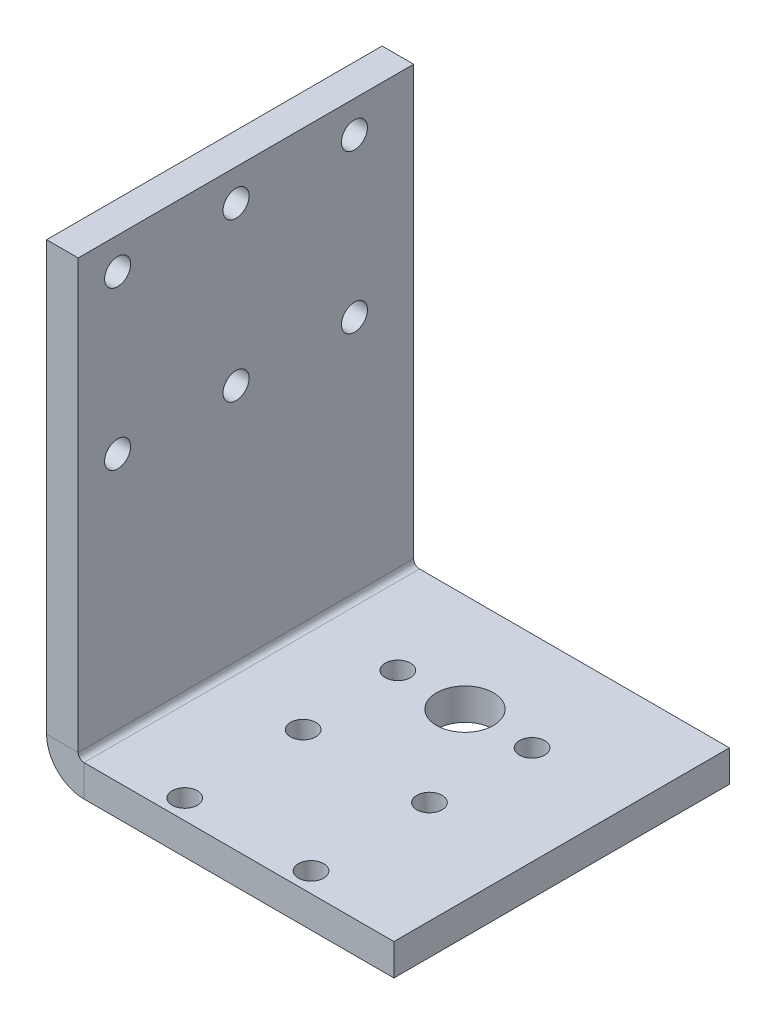
from build123d import *

# Parameters (mm, degrees)
SM_BASE_FLANGE_2_DEPTH = 21.25
HOLE_WIZARD_M3_1_D     = 3.2
SKETCH_24_R            = 3.6
CUT_EXTRUDE_2_DEPTH    = 75.381197221
M4X0_7_1_D             = 3.3
HOLE_WIZARD_M3_2_D     = 3.2
PATTERN_LINEAR_1_COUNT = 3
PATTERN_LINEAR_1_PITCH = 15


# Sheet-metal steps are written as plain solids
with BuildPart() as part:
    # 草圖16 → 基材-凸緣2 (new, symmetric)
    with BuildSketch(Plane.XY):
        with BuildLine():
            Line((40, 0), (0.7366, 0))
            ThreePointArc((0.7366, 0), (0.215745145, 0.215745145), (0, 0.7366))
            Line((0, 0.7366), (0, 55))
            Line((0, 55), (-4, 55))
            Line((-4, 55), (-4, 0.7366))
            ThreePointArc((-4, 0.7366), (-2.61268198, -2.61268198), (0.7366, -4))
            Line((0.7366, -4), (40, -4))
            Line((40, -4), (40, 0))
        make_face()
    extrude(amount=SM_BASE_FLANGE_2_DEPTH, both=True)

    # M3 餘隙孔1 (through all)
    with Locations(Plane(origin=(0, 0, 0), x_dir=(-1, 0, 0), z_dir=(0, 1, 0))):
        with Locations((-27, 18.75), (-11, 3.75), (-11, 18.75), (-27, 3.75)):
            Hole(HOLE_WIZARD_M3_1_D / 2)

    # 草圖24 → 除料-伸長2 (cut, through all)
    with BuildSketch(Plane.XZ.offset(4)):
        with Locations(Location((19, -8.75, 0), (0, 0, 270))):
            Circle(SKETCH_24_R)
    extrude(amount=-CUT_EXTRUDE_2_DEPTH, mode=Mode.SUBTRACT)

    # M4x0.7 螺紋孔1 (through all)
    with Locations(Plane(origin=(0, 0, 0), x_dir=(0, 0, 1), z_dir=(1, 0, 0))):
        with Locations((16.25, -51), (16.25, -31)):
            m4x0_7_1 = Hole(M4X0_7_1_D / 2)

    # M3 餘隙孔2 (through all)
    with Locations(Plane(origin=(0, -4, 0), x_dir=(-1, 0, 0), z_dir=(0, -1, 0))):
        with Locations((-27.5, 8.75), (-10.5, 8.75)):
            Hole(HOLE_WIZARD_M3_2_D / 2)

    # 直線複製排列1: M4x0.7 螺紋孔1 ×3
    with Locations(*[(0, 0, -i * PATTERN_LINEAR_1_PITCH) for i in range(1, PATTERN_LINEAR_1_COUNT)]):
        add(m4x0_7_1, mode=Mode.SUBTRACT)


solid = part.part
